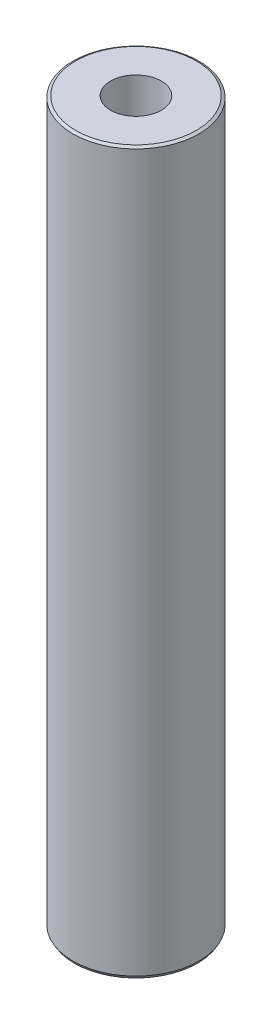
from build123d import *
from OCP.BRepFilletAPI import BRepFilletAPI_MakeChamfer

# Parameters (mm, degrees)
SKETCH1_R           = 52.5
BOSS_EXTRUDE1_DEPTH = 600
SKETCH2_R           = 21.103013177
CUT_EXTRUDE1_DEPTH  = 605.576297914
CHAMFER1_SIZE       = 1.32228673
CHAMFER1_SIZE2      = 2.290267799


with BuildPart() as part:
    # Sketch1 → Boss-Extrude1 (new body)
    with BuildSketch(Plane(origin=(0, 0, 0), x_dir=(1, 0, 0), z_dir=(0, 1, 0))):
        Circle(SKETCH1_R)
    extrude(amount=BOSS_EXTRUDE1_DEPTH)

    # Sketch2 → Cut-Extrude1 (cut, through all)
    with BuildSketch(Plane(origin=(0, 0, 0), x_dir=(1, 0, 0), z_dir=(0, 1, 0))):
        Circle(SKETCH2_R)
    extrude(amount=CUT_EXTRUDE1_DEPTH, mode=Mode.SUBTRACT)

    # Chamfer1: one chamfer whose edges measure the first distance from different faces: ONE call of the kernel's chamfer builder (chamfer() names one face for all edges)
    chamfer1_edges_1 = [part.edges().sort_by_distance(p)[0] for p in [
        (-52.5, 600, 0),
    ]]
    chamfer1_side_1 = [part.faces().sort_by_distance(p)[0] for p in [
        (-52.5, 300, 0),
    ]]
    chamfer1_edges_2 = [part.edges().sort_by_distance(p)[0] for p in [
        (-52.5, 0, 0),
    ]]
    chamfer1_side_2 = [part.faces().sort_by_distance(p)[0] for p in [
        (-51.01507576, 0, 0),
    ]]
    chamfer1 = BRepFilletAPI_MakeChamfer(part.part.solid().wrapped)
    for e in chamfer1_edges_1:
        chamfer1.Add(CHAMFER1_SIZE, CHAMFER1_SIZE2, e.wrapped, chamfer1_side_1[0].wrapped)  # the first distance lies on this face
    for e in chamfer1_edges_2:
        chamfer1.Add(CHAMFER1_SIZE, CHAMFER1_SIZE2, e.wrapped, chamfer1_side_2[0].wrapped)  # the first distance lies on this face
    add(Compound.cast(chamfer1.Shape()), mode=Mode.REPLACE)


solid = part.part
